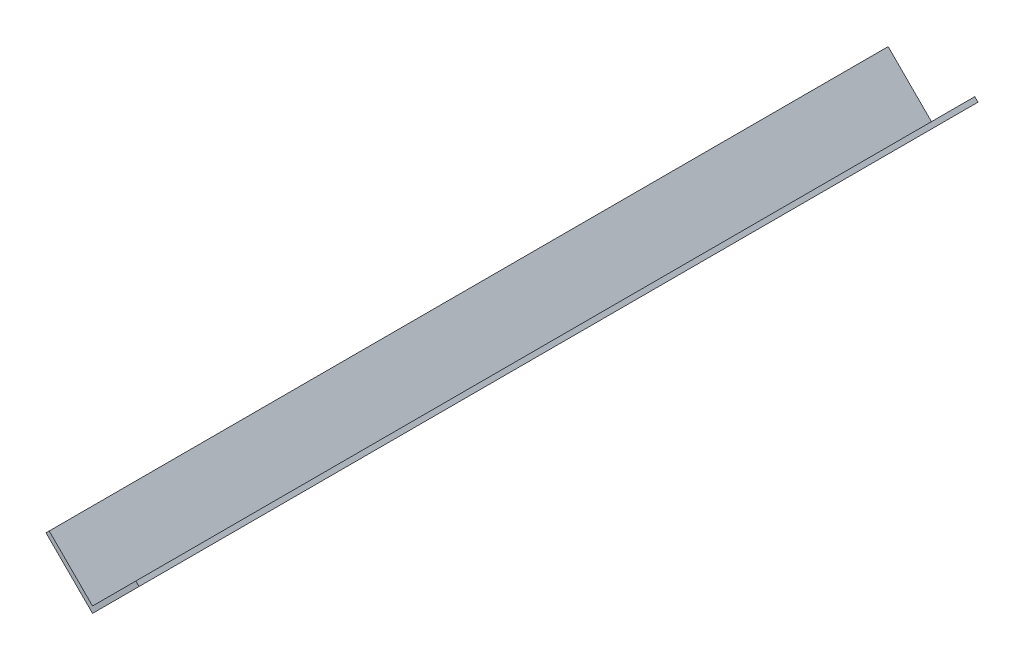
from build123d import *

# Parameters (mm, degrees)
BOSS_EXTRUDE1_DEPTH = 323.85


with BuildPart() as part:
    # Sketch1 → Boss-Extrude1 (new body)
    with BuildSketch(Plane.XY):
        Polygon((0, 0), (-17.960512242, 17.960512242), (-16.725727025, 19.195297459), (0, 2.469570433), (16.725727025, 19.195297459), (17.960512242, 17.960512242), align=None)
    extrude(amount=BOSS_EXTRUDE1_DEPTH)


solid = part.part
